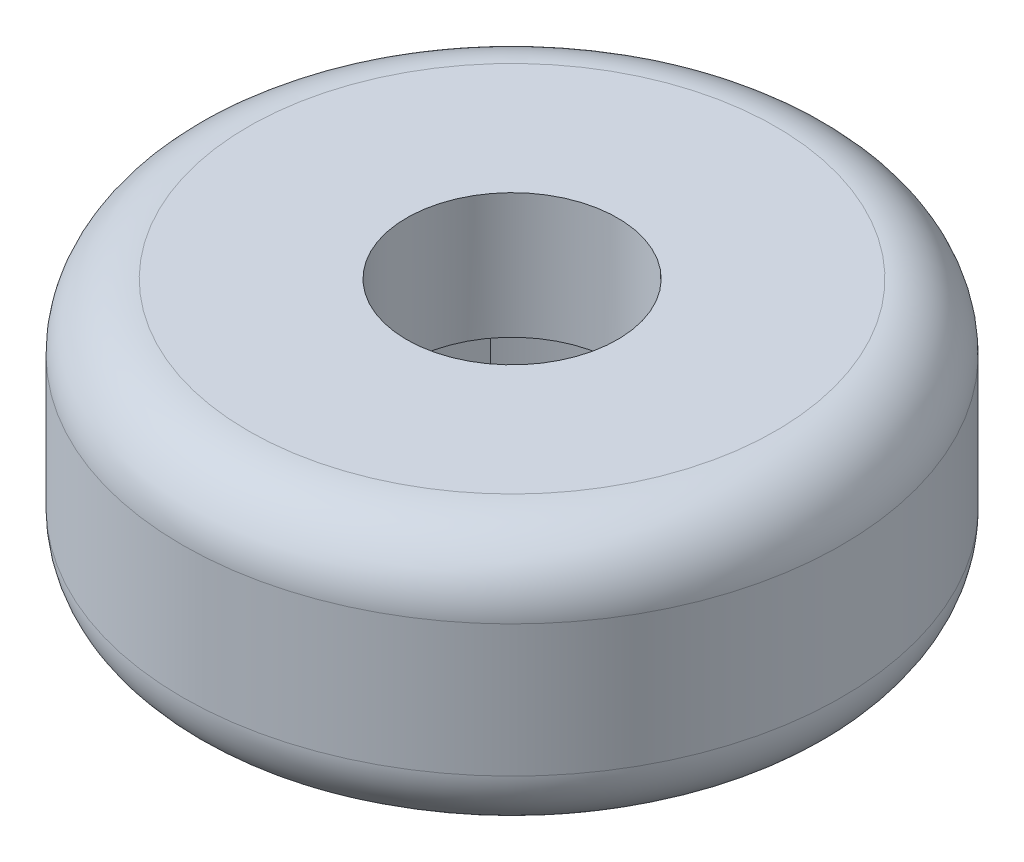
from build123d import *

# Parameters (mm, degrees)
SKETCH_1_R          = 5
EXTRUDE_1_DEPTH     = 4
CUT_EXTRUDE_1_DEPTH = 2.1
SKETCH_3_R          = 1.6
CUT_EXTRUDE_2_DEPTH = 3
FILLET_1_R          = 1


with BuildPart() as part:
    # ｽｹｯﾁ1 → ﾎﾞｽ - 押し出し1 (new body)
    with BuildSketch(Plane(origin=(0, 0, 0), x_dir=(1, 0, 0), z_dir=(0, 1, 0))):
        with Locations((-75.085298438, 13.647723363)):
            Circle(SKETCH_1_R)
    extrude(amount=EXTRUDE_1_DEPTH)

    # ｽｹｯﾁ2 → ｶｯﾄ - 押し出し1 (cut)
    with BuildSketch(Plane.XZ):
        with BuildLine():
            ThreePointArc((-72.735298438, -11.625966701), (-75.085298438, -10.547723363), (-77.435298438, -11.625966701))
            Line((-77.435298438, -11.625966701), (-77.435298438, -15.669480025))
            ThreePointArc((-77.435298438, -15.669480025), (-75.085298438, -16.747723363), (-72.735298438, -15.669480025))
            Line((-72.735298438, -15.669480025), (-72.735298438, -11.625966701))
        make_face()
    extrude(amount=-CUT_EXTRUDE_1_DEPTH, mode=Mode.SUBTRACT)

    # ｽｹｯﾁ3 → ｶｯﾄ - 押し出し2 (cut)
    with BuildSketch(Plane(origin=(0, 4, 0), x_dir=(1, 0, 0), z_dir=(0, 1, 0))):
        with Locations((-75.085298438, 13.647723363)):
            Circle(SKETCH_3_R)
    extrude(amount=-CUT_EXTRUDE_2_DEPTH, mode=Mode.SUBTRACT)

    # ﾌｨﾚｯﾄ1
    fillet_1_edges = [part.edges().sort_by_distance(p)[0] for p in [
        (-80.085298438, 0, -13.647723363),
        (-80.085298438, 4, -13.647723363),
    ]]
    fillet(fillet_1_edges, radius=FILLET_1_R)


solid = part.part
